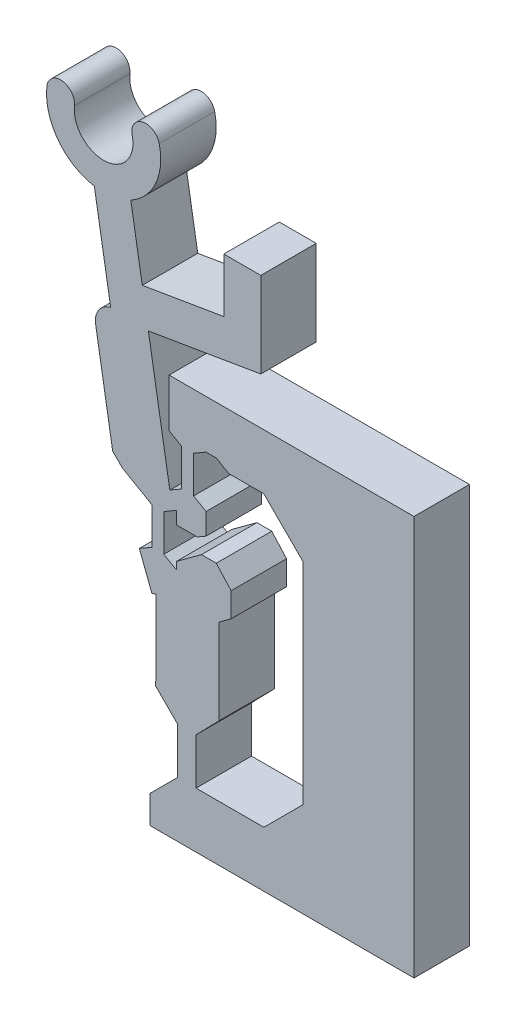
from build123d import *

# Parameters (mm, degrees)
BOSS_SWITCHMAIN_DEPTH = 3


with BuildPart() as part:
    # Sketch-SwitchBossUp → Boss-SwitchMain (new body)
    with BuildSketch(Plane.XY):
        with BuildLine():
            Line((6.540476927, 22.165014537), (6.540476927, 25.093856925))
            Line((6.540476927, 25.093856925), (8.540476927, 25.093856925))
            Line((8.540476927, 25.093856925), (8.540476927, 20.473554675))
            Line((8.540476927, 20.473554675), (2.463355023, 19.450530066))
            Line((2.463355023, 19.450530066), (3.620297651, 12.577888564))
            Line((3.620297651, 12.577888564), (4.256080915, 12.944958203))
            Line((4.256080915, 12.944958203), (4.256080915, 14.944958203))
            Line((4.256080915, 14.944958203), (3.581073513, 15.334673908))
            Line((3.581073513, 15.334673908), (3.581073513, 17.94496801))
            Line((3.581073513, 17.94496801), (6.811292922, 17.94496801))
            Line((6.811292922, 17.94496801), (16.828083018, 17.94496801))
            Line((16.828083018, 17.94496801), (16.828083018, -3.673367153))
            Line((16.828083018, -3.673367153), (5.040476927, -3.673367153))
            Line((5.040476927, -3.673367153), (2.540499132, -3.673367153))
            Line((2.540499132, -3.673367153), (2.540499132, -2.173367153))
            Line((2.540499132, -2.173367153), (4.040476927, -0.673367153))
            Line((4.040476927, -0.673367153), (4.040476927, 1.826632847))
            Line((4.040476927, 1.826632847), (2.857692557, 3.009399709))
            Line((2.857692557, 3.009399709), (2.877504246, 4.826720436))
            Line((2.877504246, 4.826720436), (2.877504246, 7.335989995))
            Line((2.877504246, 7.335989995), (2.651103927, 7.249064905))
            Line((2.651103927, 7.249064905), (1.971281627, 9.019692757))
            Line((1.971281627, 9.019692757), (2.646271341, 9.40939825))
            Line((2.646271341, 9.40939825), (2.646271341, 11.40939825))
            Line((2.646271341, 11.40939825), (1.053198631, 12.329159209))
            Line((1.053198631, 12.329159209), (0.532068352, 12.851254842))
            Line((0.532068352, 12.851254842), (-0.388805291, 18.321564484))
            ThreePointArc((-0.388805291, 18.321564484), (-0.224136417, 19.087558912), (0.421628056, 19.531238467))
            Line((0.421628056, 19.531238467), (-0.46073685, 24.772792819))
            ThreePointArc((-0.46073685, 24.772792819), (-2.424398677, 25.960025656), (-3.026553651, 28.17427473))
            ThreePointArc((-3.026553651, 28.17427473), (-2.19530667, 28.833083091), (-1.536498309, 28.001836109))
            ThreePointArc((-1.536498309, 28.001836109), (0.131578063, 26.234454713), (1.586154239, 28.18133014))
            ThreePointArc((1.586154239, 28.18133014), (2.145375848, 29.08259103), (3.046636738, 28.523369421))
            ThreePointArc((3.046636738, 28.523369421), (2.857030105, 26.554552243), (1.511513111, 25.104801997))
            Line((1.511513111, 25.104801997), (2.131345845, 21.422780026))
            Line((2.131345845, 21.422780026), (6.540476927, 22.165014537))
        make_face()
        Polygon((5.581091201, 12.555245643), (5.581099756, 11.399422818), (5.104510585, 11.124263931), (3.97126605, 11.124263931), (3.97126394, 11.79911022), (3.296271341, 11.409403061), (3.296271341, 9.409403061), (3.971278743, 9.019687356), (3.971278743, 9.409408058), (5.332971639, 10.409021979), (6.133921896, 10.409027907), (6.935397893, 9.518898634), (6.935397893, 8.203897773), (6.276166537, 7.719958375), (6.276166537, 4.826716701), (6.276166537, 3.095193505), (5.040476927, 1.826632847), (5.040476927, -0.673367153), (8.706762674, -0.673367153), (10.828083018, 1.447953191), (10.828083018, 12.823647666), (8.706762674, 14.94496801), (6.811292922, 14.94496801), (6.133921896, 15.33440512), (5.580614429, 15.33440512), (4.906080915, 14.944963014), (4.906080915, 12.944963014), align=None, mode=Mode.SUBTRACT)
    extrude(amount=BOSS_SWITCHMAIN_DEPTH)


solid = part.part
